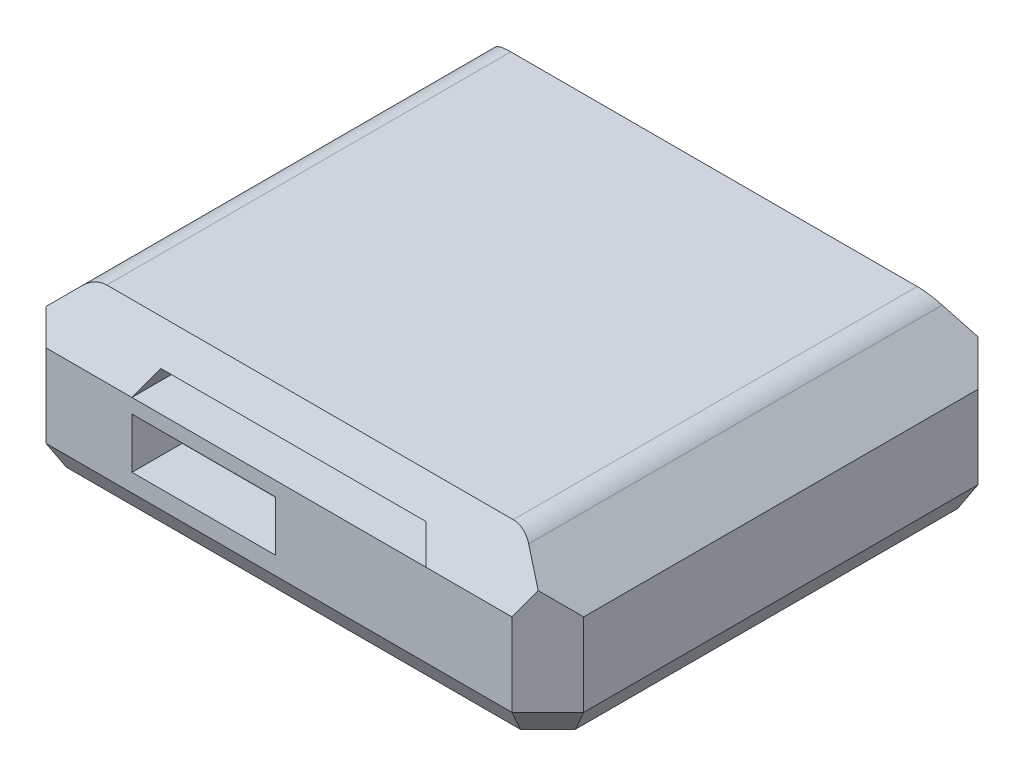
from build123d import *

# Parameters (mm, degrees)
SKETCH2_W           = 75
SKETCH2_H           = 65
BOSS_EXTRUDE1_DEPTH = 15
BOSS_EXTRUDE3_START = -5
BOSS_EXTRUDE3_DEPTH = 55
CHAMFER1_SIZE       = 5
CHAMFER1_SIZE_2     = 8.660254038
CHAMFER2_SIZE       = 8.660254038
CHAMFER2_SIZE_2     = 5
FILLET3_R           = 4
SKETCH5_W           = 51
SKETCH5_H           = 51
CUT_EXTRUDE2_DEPTH  = 13
CHAMFER3_SIZE       = 5
FILLET4_R           = 4
CUT_EXTRUDE3_DEPTH  = 1
BOSS_EXTRUDE4_DEPTH = 2
CHAMFER5_SIZE       = 0.8
CHAMFER6_SIZE       = 2
CHAMFER6_SIZE2      = 3.464101615
CUT_EXTRUDE4_REACH  = 80.342
SKETCH10_W          = 20
SKETCH10_H          = 7.035898385


with BuildPart() as part:
    # Sketch2 → Boss-Extrude1 (new body)
    with BuildSketch(Plane(origin=(0, 0, 0), x_dir=(1, 0, 0), z_dir=(0, 1, 0))):
        Rectangle(SKETCH2_W, SKETCH2_H)
    extrude(amount=BOSS_EXTRUDE1_DEPTH)

    # Sketch4 → Boss-Extrude3 (add)
    with BuildSketch(Plane.XY.offset(32.5).offset(BOSS_EXTRUDE3_START)):
        Polygon((-30, 22.5), (-37.5, 15), (-20.520725942, 15), (-18.5, 18.5), (18.5, 18.5), (20.520725942, 15), (37.5, 15), (30, 22.5), align=None)
    extrude(amount=-BOSS_EXTRUDE3_DEPTH)

    # Chamfer1
    # the kernel refuses this chamfer: 8.660254038, 5 mm, written as the material it adds along each edge
    with BuildSketch(Plane(origin=(-37.5, 15, -27.5), x_dir=(0, -0.05789386240267149, -0.9983227437537926), z_dir=(1, 0, 0))) as chamfer1_piece_1_section:
        Polygon((CHAMFER1_SIZE * 0.998322743754, CHAMFER1_SIZE * 0.0578938624027), (-CHAMFER1_SIZE_2 * 0.0578938624016, CHAMFER1_SIZE_2 * 0.998322743736), (0, 0), align=None)
    chamfer1_piece_1 = extrude(amount=39.384093911, mode=Mode.PRIVATE)
    chamfer1_piece_1 = split(chamfer1_piece_1, bisect_by=Plane(origin=(-27.856272833, 16.457627442, -32.5), z_dir=(0, 0, 1)), keep=Keep.TOP, mode=Mode.PRIVATE)
    chamfer1_piece_1 = split(chamfer1_piece_1, bisect_by=Plane(origin=(-21.723441468, 12.916835603, -29.537993549), z_dir=(-0.8660254037844403, 0.49999999999999734, 0)), keep=Keep.TOP, mode=Mode.PRIVATE)
    chamfer1_piece_1 = split(chamfer1_piece_1, bisect_by=Plane(origin=(-31.949322695, 20.550677305, -29.537993549), z_dir=(0.7071067811865487, -0.7071067811865464, 0)), keep=Keep.TOP, mode=Mode.PRIVATE)
    chamfer1_piece_1 = split(chamfer1_piece_1, bisect_by=Plane(origin=(-27.856272833, 18.5, -29.537993549), z_dir=(0, -1, 0)), keep=Keep.TOP, mode=Mode.PRIVATE)
    add(chamfer1_piece_1)
    with BuildSketch(Plane(origin=(-37.5, 15, -27.5), x_dir=(0, -0.05789386240267149, -0.9983227437537926), z_dir=(1, 0, 0))) as chamfer1_piece_2_section:
        Polygon((CHAMFER1_SIZE * 0.998322743754, CHAMFER1_SIZE * 0.0578938624027), (-CHAMFER1_SIZE_2 * 0.0578938624016, CHAMFER1_SIZE_2 * 0.998322743736), (0, 0), align=None)
    chamfer1_piece_2 = extrude(amount=39.384093911, mode=Mode.PRIVATE)
    chamfer1_piece_2 = split(chamfer1_piece_2, bisect_by=Plane(origin=(-19.426417994, 16.895396965, -28.430435977), z_dir=(-0.8660254037844403, 0.49999999999999734, 0)), keep=Keep.TOP, mode=Mode.PRIVATE)
    chamfer1_piece_2 = split(chamfer1_piece_2, bisect_by=Plane(origin=(-28.690098083, 23.809901917, -28.430435977), z_dir=(0.7071067811865487, -0.7071067811865464, 0)), keep=Keep.TOP, mode=Mode.PRIVATE)
    chamfer1_piece_2 = split(chamfer1_piece_2, bisect_by=Plane(origin=(-24.984626048, 22.5, -28.430435977), z_dir=(0, -1, 0)), keep=Keep.TOP, mode=Mode.PRIVATE)
    chamfer1_piece_2 = split(chamfer1_piece_2, bisect_by=Plane(origin=(-24.984626048, 18.5, -28.430435977), z_dir=(0, 1, 0)), keep=Keep.TOP, mode=Mode.PRIVATE)
    add(chamfer1_piece_2)
    with BuildSketch(Plane(origin=(-37.5, 15, -27.5), x_dir=(0, -0.05789386240267149, -0.9983227437537926), z_dir=(1, 0, 0))) as chamfer1_piece_3_section:
        Polygon((CHAMFER1_SIZE * 0.998322743754, CHAMFER1_SIZE * 0.0578938624027), (-CHAMFER1_SIZE_2 * 0.0578938624016, CHAMFER1_SIZE_2 * 0.998322743736), (0, 0), align=None)
    chamfer1_piece_3 = extrude(amount=39.384093911, mode=Mode.PRIVATE)
    chamfer1_piece_3 = split(chamfer1_piece_3, bisect_by=Plane(origin=(-15.142166091, 24.315938934, -28.430858153), z_dir=(0.8660254037844403, -0.49999999999999734, 0)), keep=Keep.TOP, mode=Mode.PRIVATE)
    chamfer1_piece_3 = split(chamfer1_piece_3, bisect_by=Plane(origin=(-7.845197519, 22.5, -28.430858153), z_dir=(0, -1, 0)), keep=Keep.TOP, mode=Mode.PRIVATE)
    chamfer1_piece_3 = split(chamfer1_piece_3, bisect_by=Plane(origin=(-7.845197519, 18.5, -28.430858153), z_dir=(0, 1, 0)), keep=Keep.TOP, mode=Mode.PRIVATE)
    add(chamfer1_piece_3)
    with BuildSketch(Plane(origin=(-1.884093911, 15, -27.5), x_dir=(0, -0.05789386240267149, -0.9983227437537926), z_dir=(1, 0, 0))) as chamfer1_piece_4_section:
        Polygon((CHAMFER1_SIZE * 0.998322743754, CHAMFER1_SIZE * 0.0578938624027), (-CHAMFER1_SIZE_2 * 0.0578938624016, CHAMFER1_SIZE_2 * 0.998322743736), (0, 0), align=None)
    chamfer1_piece_4 = extrude(amount=39.384093911, mode=Mode.PRIVATE)
    chamfer1_piece_4 = split(chamfer1_piece_4, bisect_by=Plane(origin=(15.142166091, 24.315938934, -28.430858153), z_dir=(-0.8660254037844395, -0.4999999999999986, 0)), keep=Keep.TOP, mode=Mode.PRIVATE)
    chamfer1_piece_4 = split(chamfer1_piece_4, bisect_by=Plane(origin=(7.845197519, 22.5, -28.430858153), z_dir=(0, -1, 0)), keep=Keep.TOP, mode=Mode.PRIVATE)
    chamfer1_piece_4 = split(chamfer1_piece_4, bisect_by=Plane(origin=(7.845197519, 18.5, -28.430858153), z_dir=(0, 1, 0)), keep=Keep.TOP, mode=Mode.PRIVATE)
    add(chamfer1_piece_4)
    with BuildSketch(Plane(origin=(-1.884093911, 15, -27.5), x_dir=(0, -0.05789386240267149, -0.9983227437537926), z_dir=(1, 0, 0))) as chamfer1_piece_5_section:
        Polygon((CHAMFER1_SIZE * 0.998322743754, CHAMFER1_SIZE * 0.0578938624027), (-CHAMFER1_SIZE_2 * 0.0578938624016, CHAMFER1_SIZE_2 * 0.998322743736), (0, 0), align=None)
    chamfer1_piece_5 = extrude(amount=39.384093911, mode=Mode.PRIVATE)
    chamfer1_piece_5 = split(chamfer1_piece_5, bisect_by=Plane(origin=(21.723441468, 12.916835603, -29.537993549), z_dir=(0.8660254037844395, 0.4999999999999986, 0)), keep=Keep.TOP, mode=Mode.PRIVATE)
    chamfer1_piece_5 = split(chamfer1_piece_5, bisect_by=Plane(origin=(27.856272833, 16.457627442, -32.5), z_dir=(0, 0, 1)), keep=Keep.TOP, mode=Mode.PRIVATE)
    chamfer1_piece_5 = split(chamfer1_piece_5, bisect_by=Plane(origin=(31.949322695, 20.550677305, -29.537993549), z_dir=(-0.7071067811865489, -0.7071067811865462, 0)), keep=Keep.TOP, mode=Mode.PRIVATE)
    chamfer1_piece_5 = split(chamfer1_piece_5, bisect_by=Plane(origin=(27.856272833, 18.5, -29.537993549), z_dir=(0, -1, 0)), keep=Keep.TOP, mode=Mode.PRIVATE)
    add(chamfer1_piece_5)
    with BuildSketch(Plane(origin=(-1.884093911, 15, -27.5), x_dir=(0, -0.05789386240267149, -0.9983227437537926), z_dir=(1, 0, 0))) as chamfer1_piece_6_section:
        Polygon((CHAMFER1_SIZE * 0.998322743754, CHAMFER1_SIZE * 0.0578938624027), (-CHAMFER1_SIZE_2 * 0.0578938624016, CHAMFER1_SIZE_2 * 0.998322743736), (0, 0), align=None)
    chamfer1_piece_6 = extrude(amount=39.384093911, mode=Mode.PRIVATE)
    chamfer1_piece_6 = split(chamfer1_piece_6, bisect_by=Plane(origin=(19.426417994, 16.895396965, -28.430435977), z_dir=(0.8660254037844395, 0.4999999999999986, 0)), keep=Keep.TOP, mode=Mode.PRIVATE)
    chamfer1_piece_6 = split(chamfer1_piece_6, bisect_by=Plane(origin=(28.690098083, 23.809901917, -28.430435977), z_dir=(-0.7071067811865489, -0.7071067811865462, 0)), keep=Keep.TOP, mode=Mode.PRIVATE)
    chamfer1_piece_6 = split(chamfer1_piece_6, bisect_by=Plane(origin=(24.984626048, 22.5, -28.430435977), z_dir=(0, -1, 0)), keep=Keep.TOP, mode=Mode.PRIVATE)
    chamfer1_piece_6 = split(chamfer1_piece_6, bisect_by=Plane(origin=(24.984626048, 18.5, -28.430435977), z_dir=(0, 1, 0)), keep=Keep.TOP, mode=Mode.PRIVATE)
    add(chamfer1_piece_6)

    # Chamfer2
    # the kernel refuses this chamfer: 8.660254038, 5 mm, written as the material it adds along each edge
    with BuildSketch(Plane(origin=(-37.5, 15, 27.5), x_dir=(0, 0.9998132206222078, -0.019326765612700497), z_dir=(1, 0, 0))) as chamfer2_piece_1_section:
        Polygon((CHAMFER2_SIZE * 0.999813220604, CHAMFER2_SIZE * 0.0193267656124), (-CHAMFER2_SIZE_2 * 0.0193267656127, CHAMFER2_SIZE_2 * 0.999813220622), (0, 0), align=None)
    chamfer2_piece_1 = extrude(amount=39.384093911, mode=Mode.PRIVATE)
    chamfer2_piece_1 = split(chamfer2_piece_1, bisect_by=Plane(origin=(-24.984626048, 22.5, 28.430435977), z_dir=(0, -1, 0)), keep=Keep.TOP, mode=Mode.PRIVATE)
    chamfer2_piece_1 = split(chamfer2_piece_1, bisect_by=Plane(origin=(-28.690098083, 23.809901917, 28.430435977), z_dir=(0.7071067811865476, -0.7071067811865476, 0)), keep=Keep.TOP, mode=Mode.PRIVATE)
    chamfer2_piece_1 = split(chamfer2_piece_1, bisect_by=Plane(origin=(-19.426417994, 16.895396965, 28.430435977), z_dir=(-0.866025403784329, 0.50000000000019, 0)), keep=Keep.TOP, mode=Mode.PRIVATE)
    chamfer2_piece_1 = split(chamfer2_piece_1, bisect_by=Plane(origin=(-24.984626048, 18.5, 28.430435977), z_dir=(0, 1, 0)), keep=Keep.TOP, mode=Mode.PRIVATE)
    add(chamfer2_piece_1)
    with BuildSketch(Plane(origin=(-37.5, 15, 27.5), x_dir=(0, 0.9998132206222078, -0.019326765612700497), z_dir=(1, 0, 0))) as chamfer2_piece_2_section:
        Polygon((CHAMFER2_SIZE * 0.999813220604, CHAMFER2_SIZE * 0.0193267656124), (-CHAMFER2_SIZE_2 * 0.0193267656127, CHAMFER2_SIZE_2 * 0.999813220622), (0, 0), align=None)
    chamfer2_piece_2 = extrude(amount=39.384093911, mode=Mode.PRIVATE)
    chamfer2_piece_2 = split(chamfer2_piece_2, bisect_by=Plane(origin=(-31.949322695, 20.550677305, 29.537993549), z_dir=(0.7071067811865476, -0.7071067811865476, 0)), keep=Keep.TOP, mode=Mode.PRIVATE)
    chamfer2_piece_2 = split(chamfer2_piece_2, bisect_by=Plane(origin=(-21.723441468, 12.916835603, 29.537993549), z_dir=(-0.866025403784329, 0.50000000000019, 0)), keep=Keep.TOP, mode=Mode.PRIVATE)
    chamfer2_piece_2 = split(chamfer2_piece_2, bisect_by=Plane(origin=(-27.856272833, 18.5, 29.537993549), z_dir=(0, -1, 0)), keep=Keep.TOP, mode=Mode.PRIVATE)
    chamfer2_piece_2 = split(chamfer2_piece_2, bisect_by=Plane(origin=(-27.856272833, 16.457627442, 32.5), z_dir=(0, 0, -1)), keep=Keep.TOP, mode=Mode.PRIVATE)
    add(chamfer2_piece_2)
    with BuildSketch(Plane(origin=(-37.5, 15, 27.5), x_dir=(0, 0.9998132206222078, -0.019326765612700497), z_dir=(1, 0, 0))) as chamfer2_piece_3_section:
        Polygon((CHAMFER2_SIZE * 0.999813220604, CHAMFER2_SIZE * 0.0193267656124), (-CHAMFER2_SIZE_2 * 0.0193267656127, CHAMFER2_SIZE_2 * 0.999813220622), (0, 0), align=None)
    chamfer2_piece_3 = extrude(amount=39.384093911, mode=Mode.PRIVATE)
    chamfer2_piece_3 = split(chamfer2_piece_3, bisect_by=Plane(origin=(-7.845197519, 22.5, 28.430858153), z_dir=(0, -1, 0)), keep=Keep.TOP, mode=Mode.PRIVATE)
    chamfer2_piece_3 = split(chamfer2_piece_3, bisect_by=Plane(origin=(-15.142166091, 24.315938934, 28.430858153), z_dir=(0.866025403784329, -0.50000000000019, 0)), keep=Keep.TOP, mode=Mode.PRIVATE)
    chamfer2_piece_3 = split(chamfer2_piece_3, bisect_by=Plane(origin=(-7.845197519, 18.5, 28.430858153), z_dir=(0, 1, 0)), keep=Keep.TOP, mode=Mode.PRIVATE)
    add(chamfer2_piece_3)
    with BuildSketch(Plane(origin=(-1.884093911, 15, 27.5), x_dir=(0, 0.9998132206222078, -0.019326765612700497), z_dir=(1, 0, 0))) as chamfer2_piece_4_section:
        Polygon((CHAMFER2_SIZE * 0.999813220604, CHAMFER2_SIZE * 0.0193267656124), (-CHAMFER2_SIZE_2 * 0.0193267656127, CHAMFER2_SIZE_2 * 0.999813220622), (0, 0), align=None)
    chamfer2_piece_4 = extrude(amount=39.384093911, mode=Mode.PRIVATE)
    chamfer2_piece_4 = split(chamfer2_piece_4, bisect_by=Plane(origin=(7.845197519, 22.5, 28.430858153), z_dir=(0, -1, 0)), keep=Keep.TOP, mode=Mode.PRIVATE)
    chamfer2_piece_4 = split(chamfer2_piece_4, bisect_by=Plane(origin=(7.845197519, 18.5, 28.430858153), z_dir=(0, 1, 0)), keep=Keep.TOP, mode=Mode.PRIVATE)
    chamfer2_piece_4 = split(chamfer2_piece_4, bisect_by=Plane(origin=(15.142166091, 24.315938934, 28.430858153), z_dir=(-0.866025403784329, -0.50000000000019, 0)), keep=Keep.TOP, mode=Mode.PRIVATE)
    add(chamfer2_piece_4)
    with BuildSketch(Plane(origin=(-1.884093911, 15, 27.5), x_dir=(0, 0.9998132206222078, -0.019326765612700497), z_dir=(1, 0, 0))) as chamfer2_piece_5_section:
        Polygon((CHAMFER2_SIZE * 0.999813220604, CHAMFER2_SIZE * 0.0193267656124), (-CHAMFER2_SIZE_2 * 0.0193267656127, CHAMFER2_SIZE_2 * 0.999813220622), (0, 0), align=None)
    chamfer2_piece_5 = extrude(amount=39.384093911, mode=Mode.PRIVATE)
    chamfer2_piece_5 = split(chamfer2_piece_5, bisect_by=Plane(origin=(28.690098083, 23.809901917, 28.430435977), z_dir=(-0.7071067811865476, -0.7071067811865476, 0)), keep=Keep.TOP, mode=Mode.PRIVATE)
    chamfer2_piece_5 = split(chamfer2_piece_5, bisect_by=Plane(origin=(24.984626048, 22.5, 28.430435977), z_dir=(0, -1, 0)), keep=Keep.TOP, mode=Mode.PRIVATE)
    chamfer2_piece_5 = split(chamfer2_piece_5, bisect_by=Plane(origin=(24.984626048, 18.5, 28.430435977), z_dir=(0, 1, 0)), keep=Keep.TOP, mode=Mode.PRIVATE)
    chamfer2_piece_5 = split(chamfer2_piece_5, bisect_by=Plane(origin=(19.426417994, 16.895396965, 28.430435977), z_dir=(0.866025403784329, 0.50000000000019, 0)), keep=Keep.TOP, mode=Mode.PRIVATE)
    add(chamfer2_piece_5)
    with BuildSketch(Plane(origin=(-1.884093911, 15, 27.5), x_dir=(0, 0.9998132206222078, -0.019326765612700497), z_dir=(1, 0, 0))) as chamfer2_piece_6_section:
        Polygon((CHAMFER2_SIZE * 0.999813220604, CHAMFER2_SIZE * 0.0193267656124), (-CHAMFER2_SIZE_2 * 0.0193267656127, CHAMFER2_SIZE_2 * 0.999813220622), (0, 0), align=None)
    chamfer2_piece_6 = extrude(amount=39.384093911, mode=Mode.PRIVATE)
    chamfer2_piece_6 = split(chamfer2_piece_6, bisect_by=Plane(origin=(31.949322695, 20.550677305, 29.537993549), z_dir=(-0.7071067811865476, -0.7071067811865476, 0)), keep=Keep.TOP, mode=Mode.PRIVATE)
    chamfer2_piece_6 = split(chamfer2_piece_6, bisect_by=Plane(origin=(27.856272833, 18.5, 29.537993549), z_dir=(0, -1, 0)), keep=Keep.TOP, mode=Mode.PRIVATE)
    chamfer2_piece_6 = split(chamfer2_piece_6, bisect_by=Plane(origin=(21.723441468, 12.916835603, 29.537993549), z_dir=(0.866025403784329, 0.50000000000019, 0)), keep=Keep.TOP, mode=Mode.PRIVATE)
    chamfer2_piece_6 = split(chamfer2_piece_6, bisect_by=Plane(origin=(27.856272833, 16.457627442, 32.5), z_dir=(0, 0, -1)), keep=Keep.TOP, mode=Mode.PRIVATE)
    add(chamfer2_piece_6)

    # Fillet3
    fillet3_edges = [part.edges().sort_by_distance(p)[0] for p in [
        (-30, 22.5, 0),
        (30, 22.5, 0),
    ]]
    fillet(fillet3_edges, radius=FILLET3_R)

    # Sketch5 → Cut-Extrude2 (cut)
    with BuildSketch(Plane.XZ):
        with Locations((-7, 0)):
            Rectangle(SKETCH5_W, SKETCH5_H)
    extrude(amount=-CUT_EXTRUDE2_DEPTH, mode=Mode.SUBTRACT)

    # Chamfer3
    chamfer3_edges = [part.edges().sort_by_distance(p)[0] for p in [
        (-37.5, 7.5, -32.5),
        (37.5, 7.5, -32.5),
        (37.5, 7.5, 32.5),
        (-37.5, 7.5, 32.5),
    ]]
    chamfer(chamfer3_edges, length=CHAMFER3_SIZE)

    # Fillet4
    fillet4_edges = [part.edges().sort_by_distance(p)[0] for p in [
        (18.5, 6.5, -25.5),
        (18.5, 6.5, 25.5),
        (-32.5, 6.5, 25.5),
        (-32.5, 6.5, -25.5),
    ]]
    fillet(fillet4_edges, radius=FILLET4_R)

    # Sketch7 → Cut-Extrude3 (cut)
    with BuildSketch(Plane.XZ):
        Polygon((27.4, 12.233709128), (21.42984865, 3.863865625), (27.4, 5.91955359), align=None)
        Polygon((21.406466325, 3.644290309), (27.4, 5.708029454), (27.4, 0.590432369), align=None)
        Polygon((21.52230088, 2.23847817), (27.4, -0.756359116), (27.4, -4.766290872), align=None)
        Polygon((27.6, 5.708029454), (27.6, 0.590432369), (33.593533675, 3.644290309), align=None)
        Polygon((27.6, -0.756359116), (27.6, -4.766290872), (33.47769912, 2.23847817), align=None)
        Polygon((33.57015135, 3.863865625), (27.6, 5.91955359), (27.6, 12.233709128), align=None)
    extrude(amount=-CUT_EXTRUDE3_DEPTH, mode=Mode.SUBTRACT)

    # Sketch9 → Boss-Extrude4 (add)
    with BuildSketch(Plane.XZ):
        with BuildLine():
            Line((20.5, -12), (20.5, -9))
            ThreePointArc((20.5, -9), (22, -7.5), (23.5, -9))
            Line((23.5, -9), (23.5, -12))
            ThreePointArc((23.5, -12), (22, -13.5), (20.5, -12))
        make_face()
        with BuildLine():
            Line((20.5, -20), (20.5, -17))
            ThreePointArc((20.5, -17), (22, -15.5), (23.5, -17))
            Line((23.5, -17), (23.5, -20))
            ThreePointArc((23.5, -20), (22, -21.5), (20.5, -20))
        make_face()
    extrude(amount=BOSS_EXTRUDE4_DEPTH)

    # Chamfer5
    chamfer5_edges = [part.edges().sort_by_distance(p)[0] for p in [
        (22, -2, -13.5),
        (23.5, -2, -10.5),
        (22, -2, -7.5),
        (20.5, -2, -10.5),
        (22, -2, -21.5),
        (23.5, -2, -18.5),
        (22, -2, -15.5),
        (20.5, -2, -18.5),
    ]]
    chamfer(chamfer5_edges, length=CHAMFER5_SIZE)

    # Chamfer6
    chamfer6_edges = [part.edges().sort_by_distance(p)[0] for p in [
        (37.5, 0, 0),
        (-37.5, 0, 0),
        (0, 0, -32.5),
        (0, 0, 32.5),
        (35, 0, -30),
        (-35, 0, -30),
        (-35, 0, 30),
        (35, 0, 30),
    ]]
    chamfer6_side = [part.faces().sort_by_distance(p)[0] for p in [
        (0, 0, 31.507528338),
    ]]
    chamfer(chamfer6_edges, length=CHAMFER6_SIZE, length2=CHAMFER6_SIZE2, reference=chamfer6_side[0])

    # Sketch10 → Cut-Extrude4 (cut, up to next)
    with BuildSketch(Plane.XY.offset(32.5), mode=Mode.PRIVATE) as cut_extrude4_sk1:
        with Locations((-10.5, 9.482050808)):
            Rectangle(SKETCH10_W, SKETCH10_H)
    cut_extrude4_tool1 = extrude(cut_extrude4_sk1.sketch, amount=-CUT_EXTRUDE4_REACH, mode=Mode.PRIVATE) & part.part
    add(cut_extrude4_tool1.solids().sort_by_distance((-10.5, 9.482051, 32.5))[0], mode=Mode.SUBTRACT)


solid = part.part
